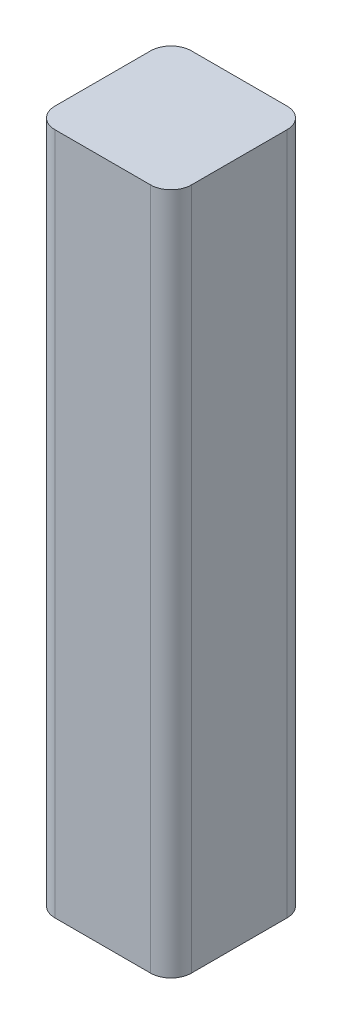
from build123d import *

# Parameters (mm, degrees)
SKETCH1_W           = 20
SKETCH1_H           = 20
BOSS_EXTRUDE1_DEPTH = 100
FILLET1_R           = 3


with BuildPart() as part:
    # Sketch1 → Boss-Extrude1 (new body)
    with BuildSketch(Plane(origin=(0, 0, 0), x_dir=(1, 0, 0), z_dir=(0, 1, 0))):
        Rectangle(SKETCH1_W, SKETCH1_H)
    extrude(amount=BOSS_EXTRUDE1_DEPTH)

    # Fillet1
    fillet1_edges = [part.edges().sort_by_distance(p)[0] for p in [
        (10, 50, -10),
        (10, 50, 10),
        (-10, 50, 10),
        (-10, 50, -10),
    ]]
    fillet(fillet1_edges, radius=FILLET1_R)


solid = part.part
